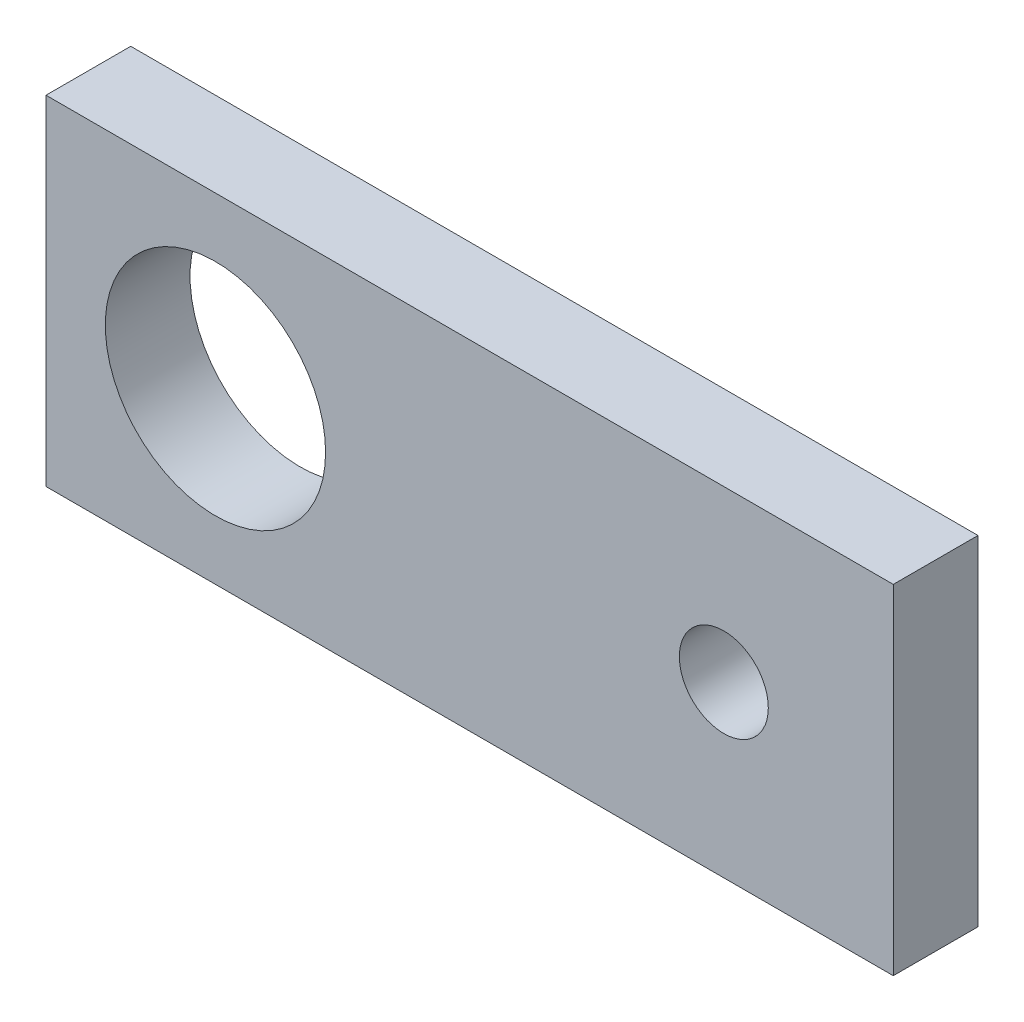
from build123d import *

# Parameters (mm, degrees)
SKETCH1_W               = 20
SKETCH1_H               = 8
SKETCH1_R               = 2.6
SKETCH1_R_2             = 1.05
R12_HORN_ENVELOPE_DEPTH = 2


with BuildPart() as part:
    # Sketch1 → R12_Horn_Envelope (new body)
    with BuildSketch(Plane.XY):
        with Locations((6, 0)):
            Rectangle(SKETCH1_W, SKETCH1_H)
        Circle(SKETCH1_R, mode=Mode.SUBTRACT)
        with Locations((12, 0)):
            Circle(SKETCH1_R_2, mode=Mode.SUBTRACT)
    extrude(amount=R12_HORN_ENVELOPE_DEPTH)


solid = part.part
